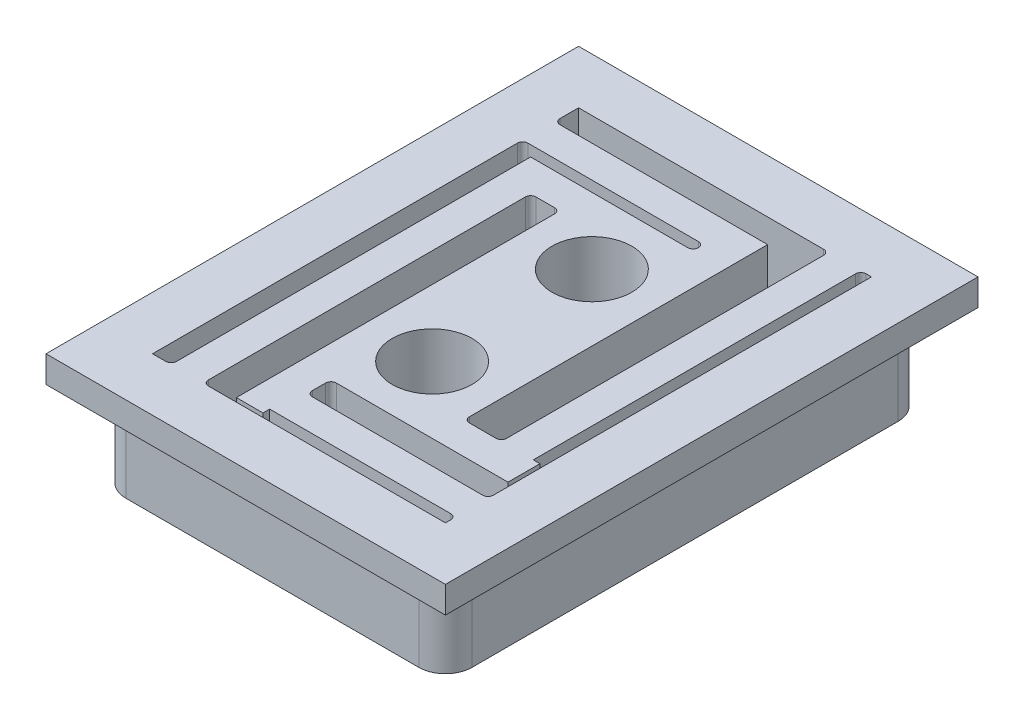
from build123d import *

# Parameters (mm, degrees)
SKETCH1_W           = 13
SKETCH1_H           = 18
BOSS_EXTRUDE1_DEPTH = 3.2
SKETCH2_W           = 15
SKETCH2_H           = 20
BOSS_EXTRUDE2_DEPTH = 1
SKETCH3_R           = 1.5
CUT_EXTRUDE1_DEPTH  = 14.18673576
FILLET1_R           = 0.2
FILLET2_R           = 1


with BuildPart() as part:
    # Sketch1 → Boss-Extrude1 (new body)
    with BuildSketch(Plane(origin=(0, 0, 0), x_dir=(1, 0, 0), z_dir=(0, 1, 0))):
        Rectangle(SKETCH1_W, SKETCH1_H)
    extrude(amount=BOSS_EXTRUDE1_DEPTH)

    # Sketch2 → Boss-Extrude2 (add)
    with BuildSketch(Plane(origin=(0, 3.2, 0), x_dir=(1, 0, 0), z_dir=(0, 1, 0))):
        Rectangle(SKETCH2_W, SKETCH2_H)
    extrude(amount=BOSS_EXTRUDE2_DEPTH)

    # Sketch3 → Cut-Extrude1 (cut, through all)
    with BuildSketch(Plane.XZ):
        with Locations(Location((0, 3, 0), (0, 0, 270))):
            Circle(SKETCH3_R)
        with Locations(Location((0, -3, 0), (0, 0, 270))):
            Circle(SKETCH3_R)
        Polygon((4.8, -5.5), (-1.3, -5.5), (-1.3, -5.9), (5.5, -5.9), (5.5, 8), (4.8, 8), align=None)
        Polygon((2.5, 7.85), (2.5, -4.3), (3.6, -4.3), (3.6, 8), (-5.5, 8), (-5.5, 7.6), (1.5, 7.6), (1.5, 7.85), align=None)
        Polygon((-2.5, -7.1), (-2.5, 4.3), (-3.9, 4.3), (-3.9, -8), (5.5, -8), (5.5, -7.1), align=None)
        Polygon((-5.35, 5.5), (1.3, 5.5), (1.3, 6.4), (-5.5, 6.4), (-5.5, -8), (-5.1, -8), (-5.1, 4.3), (-5.35, 4.3), align=None)
    extrude(amount=-CUT_EXTRUDE1_DEPTH, mode=Mode.SUBTRACT)

    # Fillet1
    fillet1_edges = [part.edges().sort_by_distance(p)[0] for p in [
        (-5.1, 2.1, -8),
        (-3.9, 2.1, -8),
        (-5.5, 2.1, 6.4),
        (-5.5, 2.1, 7.6),
        (4.8, 2.1, 8),
        (3.6, 2.1, 8),
        (-3.9, 2.1, 4.3),
        (-2.5, 2.1, 4.3),
        (1.3, 2.1, 5.5),
        (1.3, 2.1, 6.4),
        (5.5, 2.1, -7.1),
        (5.5, 2.1, -5.9),
        (-1.3, 2.1, -5.9),
        (-1.3, 2.1, -5.5),
        (3.6, 2.1, -4.3),
        (2.5, 2.1, -4.3),
    ]]
    fillet(fillet1_edges, radius=FILLET1_R - 0.0001)  # a hair under: the kernel refuses the full size

    # Fillet2
    fillet2_edges = [part.edges().sort_by_distance(p)[0] for p in [
        (6.5, 1.6, 9),
        (-6.5, 1.6, 9),
        (-6.5, 1.6, -9),
        (6.5, 1.6, -9),
    ]]
    fillet(fillet2_edges, radius=FILLET2_R)


with BuildPart() as body_2:
    # Mirror1: mirrored copy
    add(part.part.mirror(Plane(origin=(-7.5, 4.2, -10), x_dir=(0, 0, 1), z_dir=(1, 0, 0))))


solid = body_2.part
